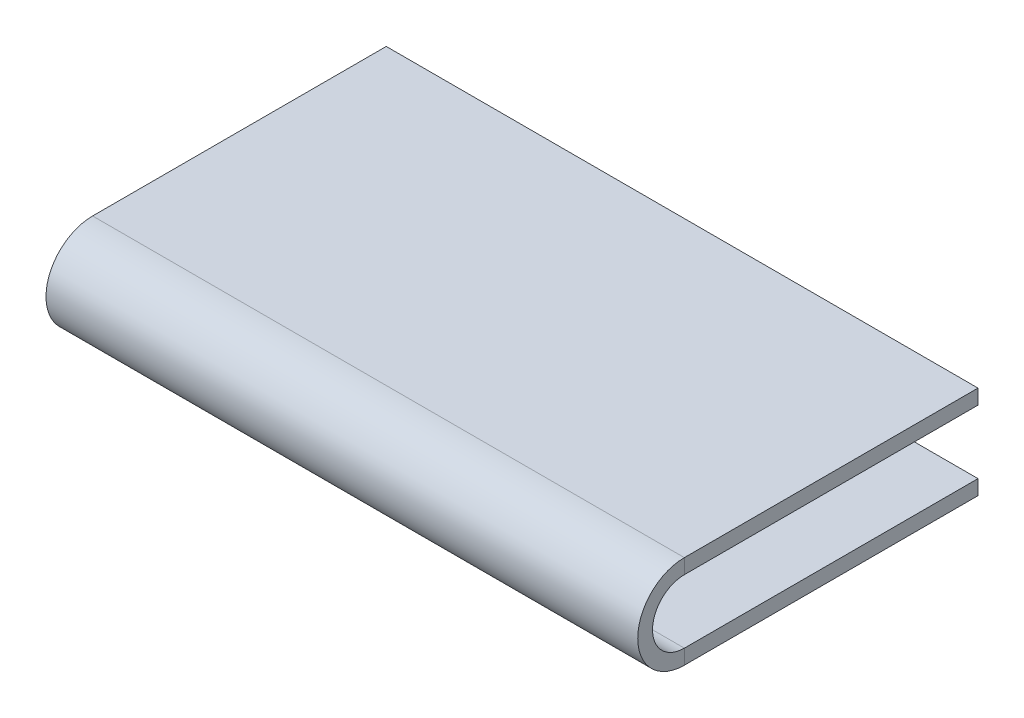
from build123d import *

# Parameters (mm, degrees)
TABAN_FLAN_1_DEPTH = 40


# Sheet-metal steps are written as plain solids
with BuildPart() as part:
    # Çizim1 → Taban-Flanş1 (new body)
    with BuildSketch(Plane.YZ):
        with BuildLine():
            Line((0, 0), (0, 19.85))
            ThreePointArc((0, 19.85), (2.15, 22), (4.3, 19.85))
            Line((4.3, 19.85), (4.3, 0))
            Line((4.3, 0), (5.3, 0))
            Line((5.3, 0), (5.3, 19.85))
            ThreePointArc((5.3, 19.85), (2.15, 23), (-1, 19.85))
            Line((-1, 19.85), (-1, 0))
            Line((-1, 0), (0, 0))
        make_face()
    extrude(amount=TABAN_FLAN_1_DEPTH)


solid = part.part
